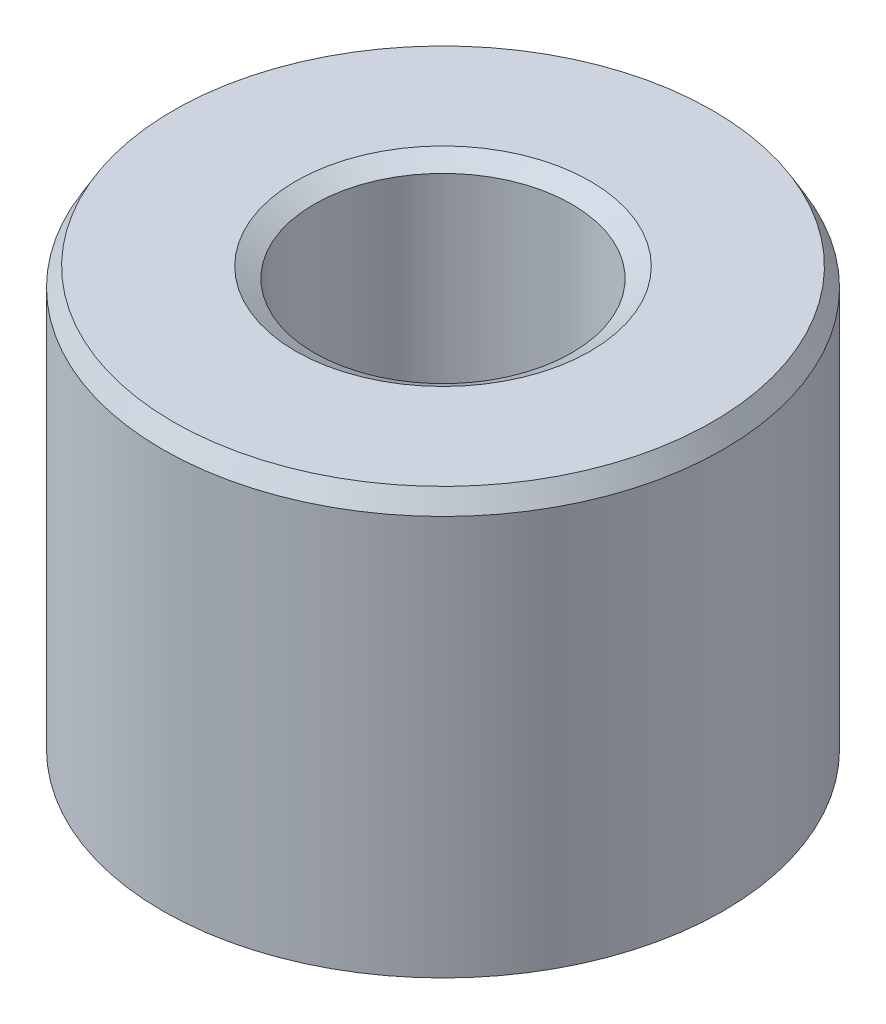
from build123d import *
from OCP.BRepFilletAPI import BRepFilletAPI_MakeChamfer

# Parameters (mm, degrees)
SKETCH1_R           = 10
BOSS_EXTRUDE1_DEPTH = 15.294510858
SKETCH2_R           = 4.593329998
CUT_EXTRUDE1_DEPTH  = 21.83079601
CHAMFER1_SIZE       = 0.659939041
CHAMFER1_SIZE2      = 0.381015983


with BuildPart() as part:
    # Sketch1 → Boss-Extrude1 (new body)
    with BuildSketch(Plane(origin=(0, 0, 0), x_dir=(1, 0, 0), z_dir=(0, 1, 0))):
        Circle(SKETCH1_R)
    extrude(amount=BOSS_EXTRUDE1_DEPTH)

    # Sketch2 → Cut-Extrude1 (cut, through all)
    with BuildSketch(Plane(origin=(0, 0, 0), x_dir=(1, 0, 0), z_dir=(0, 1, 0))):
        Circle(SKETCH2_R)
    extrude(amount=CUT_EXTRUDE1_DEPTH, mode=Mode.SUBTRACT)

    # Chamfer1: one chamfer whose edges measure the first distance from different faces: ONE call of the kernel's chamfer builder (chamfer() names one face for all edges)
    chamfer1_edges_1 = [part.edges().sort_by_distance(p)[0] for p in [
        (-4.593329998, 15.294510858, 0),
    ]]
    chamfer1_side_1 = [part.faces().sort_by_distance(p)[0] for p in [
        (-9.717157288, 15.294510858, 0),
    ]]
    chamfer1_edges_2 = [part.edges().sort_by_distance(p)[0] for p in [
        (-4.593329998, 0, 0),
    ]]
    chamfer1_side_2 = [part.faces().sort_by_distance(p)[0] for p in [
        (-4.593329998, 7.647255429, 0),
    ]]
    chamfer1_edges_3 = [part.edges().sort_by_distance(p)[0] for p in [
        (-10, 0, 0),
    ]]
    chamfer1_side_3 = [part.faces().sort_by_distance(p)[0] for p in [
        (-9.717157288, 0, 0),
    ]]
    chamfer1_edges_4 = [part.edges().sort_by_distance(p)[0] for p in [
        (-10, 15.294510858, 0),
    ]]
    chamfer1_side_4 = [part.faces().sort_by_distance(p)[0] for p in [
        (-10, 7.647255429, 0),
    ]]
    chamfer1 = BRepFilletAPI_MakeChamfer(part.part.solid().wrapped)
    for e in chamfer1_edges_1:
        chamfer1.Add(CHAMFER1_SIZE, CHAMFER1_SIZE2, e.wrapped, chamfer1_side_1[0].wrapped)  # the first distance lies on this face
    for e in chamfer1_edges_2:
        chamfer1.Add(CHAMFER1_SIZE, CHAMFER1_SIZE2, e.wrapped, chamfer1_side_2[0].wrapped)  # the first distance lies on this face
    for e in chamfer1_edges_3:
        chamfer1.Add(CHAMFER1_SIZE, CHAMFER1_SIZE2, e.wrapped, chamfer1_side_3[0].wrapped)  # the first distance lies on this face
    for e in chamfer1_edges_4:
        chamfer1.Add(CHAMFER1_SIZE, CHAMFER1_SIZE2, e.wrapped, chamfer1_side_4[0].wrapped)  # the first distance lies on this face
    add(Compound.cast(chamfer1.Shape()), mode=Mode.REPLACE)


solid = part.part
